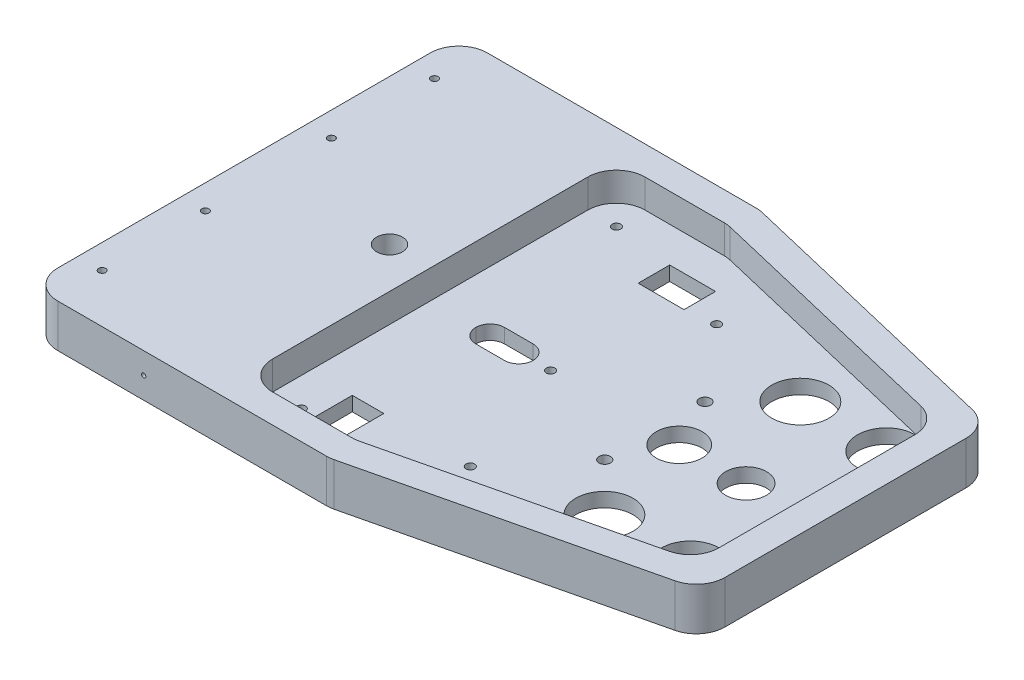
from build123d import *

# Parameters (mm, degrees)
ESBO_O1_R                = 4.5
ESBO_O1_R_2              = 7.14
ESBO_O1_R_3              = 8
ESBO_O1_R_4              = 1.25
RESSALTO_EXTRUS_O1_DEPTH = 15
CORTE_EXTRUS_O2_DEPTH    = 10
FILETE1_R                = 10
ESBO_O5_R                = 2
ESBO_O5_W                = 20
ESBO_O5_H                = 10
CORTE_EXTRUS_O4_DEPTH    = 224.494966386
FILETE2_R                = 5
ESBO_O6_R                = 10
CORTE_EXTRUS_O5_DEPTH    = 224.494966386
ESBO_O7_W                = 11
ESBO_O7_H                = 16
ESBO_O7_W_2              = 16
ESBO_O7_H_2              = 11
ESBO_O7_R                = 1.5
CORTE_EXTRUS_O6_DEPTH    = 224.494966386
ESBO_O8_R                = 0.75
CORTE_EXTRUS_O7_DEPTH    = 259.505319094


with BuildPart() as part:
    # Esboço1 → Ressalto-extrusão1 (new body)
    with BuildSketch(Plane(origin=(0, 0, 0), x_dir=(1, 0, 0), z_dir=(0, 1, 0))):
        Polygon((210, 50), (105, 75), (0, 75), (0, -75), (105, -75), (210, -50), align=None)
        with Locations(Location((50.8, 0, 0), (0, 0, 270))):
            Circle(ESBO_O1_R, mode=Mode.SUBTRACT)
        with Locations(Location((175.26, 0, 0), (0, 0, 270))):
            Circle(ESBO_O1_R_2, mode=Mode.SUBTRACT)
        with Locations(Location((151.92, 0, 0), (0, 0, 270))):
            Circle(ESBO_O1_R_3, mode=Mode.SUBTRACT)
        with Locations(Location((8.5, -58, 0), (0, 0, 270))):
            Circle(ESBO_O1_R_4, mode=Mode.SUBTRACT)
        with Locations(Location((8.5, -22, 0), (0, 0, 270))):
            Circle(ESBO_O1_R_4, mode=Mode.SUBTRACT)
        with Locations(Location((8.5, 22, 0), (0, 0, 90))):
            Circle(ESBO_O1_R_4, mode=Mode.SUBTRACT)
        with Locations(Location((8.5, 58, 0), (0, 0, 90))):
            Circle(ESBO_O1_R_4, mode=Mode.SUBTRACT)
    extrude(amount=RESSALTO_EXTRUS_O1_DEPTH)

    # Esboço3 → Corte-extrusão2 (cut)
    with BuildSketch(Plane(origin=(0, 15, 0), x_dir=(1, 0, 0), z_dir=(0, 1, 0))):
        Polygon((200, 42.101412788), (200, -42.101412788), (103.82593371, -65), (65, -65), (65, 65), (103.82593371, 65), align=None)
    extrude(amount=-CORTE_EXTRUS_O2_DEPTH, mode=Mode.SUBTRACT)

    # Filete1
    filete1_edges = [part.edges().sort_by_distance(p)[0] for p in [
        (0, 7.5, -75),
        (105, 7.5, -75),
        (210, 7.5, -50),
        (210, 7.5, 50),
        (105, 7.5, 75),
        (0, 7.5, 75),
        (65, 10, 65),
        (65, 10, -65),
        (103.82593371, 10, -65),
        (200, 10, -42.101412788),
        (200, 10, 42.101412788),
        (103.82593371, 10, 65),
    ]]
    fillet(filete1_edges, radius=FILETE1_R)

    # Esboço5 → Corte-extrusão4 (cut, through all)
    with BuildSketch(Plane.XZ):
        with Locations(Location((143.42, 17.5, 0), (0, 0, 270))):
            Circle(ESBO_O5_R)
        with Locations(Location((143.42, -17.5, 0), (0, 0, 270))):
            Circle(ESBO_O5_R)
        with Locations((90.92, 0)):
            Rectangle(ESBO_O5_W, ESBO_O5_H)
    extrude(amount=-CORTE_EXTRUS_O4_DEPTH, mode=Mode.SUBTRACT)

    # Filete2
    filete2_edges = [part.edges().sort_by_distance(p)[0] for p in [
        (80.92, 2.5, -5),
        (80.92, 2.5, 5),
        (100.92, 2.5, 5),
        (100.92, 2.5, -5),
    ]]
    fillet(filete2_edges, radius=FILETE2_R - 0.0001)  # a hair under: the kernel refuses the full size

    # Esboço6 → Corte-extrusão5 (cut, through all)
    with BuildSketch(Plane(origin=(0, 15, 0), x_dir=(1, 0, 0), z_dir=(0, 1, 0))):
        with Locations(Location((190, -34.202825576, 0), (0, 0, 270))):
            Circle(ESBO_O6_R)
        with Locations(Location((190, 34.202825576, 0), (0, 0, 90))):
            Circle(ESBO_O6_R)
        with Locations(Location((160, 34.202825576, 0), (0, 0, 270))):
            Circle(ESBO_O6_R)
        with Locations(Location((160, -34.202825576, 0), (0, 0, 270))):
            Circle(ESBO_O6_R)
    extrude(amount=-CORTE_EXTRUS_O5_DEPTH, mode=Mode.SUBTRACT)

    # Esboço7 → Corte-extrusão6 (cut, through all)
    with BuildSketch(Plane.XZ):
        with Locations((85.4, 50.1)):
            Rectangle(ESBO_O7_W, ESBO_O7_H)
        with Locations((103.9, -47.2)):
            Rectangle(ESBO_O7_W_2, ESBO_O7_H_2)
        with Locations(Location((75, 55, 0), (0, 0, 270))):
            Circle(ESBO_O7_R)
        with Locations(Location((122, 43, 0), (0, 0, 270))):
            Circle(ESBO_O7_R)
        with Locations(Location((107, 0, 0), (0, 0, 270))):
            Circle(ESBO_O7_R)
        with Locations(Location((75, -55, 0), (0, 0, 270))):
            Circle(ESBO_O7_R)
        with Locations(Location((122, -43, 0), (0, 0, 270))):
            Circle(ESBO_O7_R)
    extrude(amount=-CORTE_EXTRUS_O6_DEPTH, mode=Mode.SUBTRACT)

    # Esboço8 → Corte-extrusão7 (cut, through all)
    with BuildSketch(Plane.XY.offset(75)):
        with Locations((40, 7.5)):
            Circle(ESBO_O8_R)
    extrude(amount=-CORTE_EXTRUS_O7_DEPTH, mode=Mode.SUBTRACT)


solid = part.part
